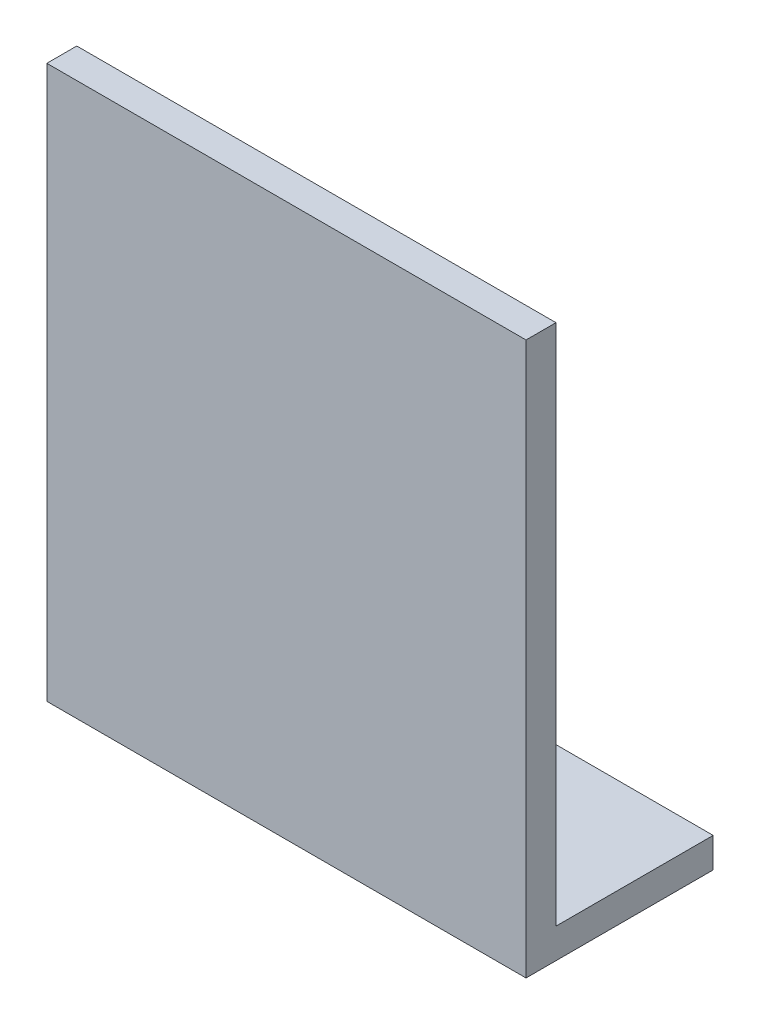
from build123d import *

# Parameters (mm, degrees)
SKETCH1_W           = 32.007575758
SKETCH1_H           = 12.5
BOSS_EXTRUDE1_DEPTH = 2
SKETCH2_W           = 32.007575758
SKETCH2_H           = 34.908526865
BOSS_EXTRUDE2_DEPTH = 2


with BuildPart() as part:
    # Sketch1 → Boss-Extrude1 (new body)
    with BuildSketch(Plane(origin=(0, 0, 0), x_dir=(1, 0, 0), z_dir=(0, 1, 0))):
        with Locations((16.003787879, 6.25)):
            Rectangle(SKETCH1_W, SKETCH1_H)
    extrude(amount=BOSS_EXTRUDE1_DEPTH)

    # Sketch2 → Boss-Extrude2 (add)
    with BuildSketch(Plane.XY):
        with Locations((16.003787879, 19.454263432)):
            Rectangle(SKETCH2_W, SKETCH2_H)
    extrude(amount=-BOSS_EXTRUDE2_DEPTH)


solid = part.part
